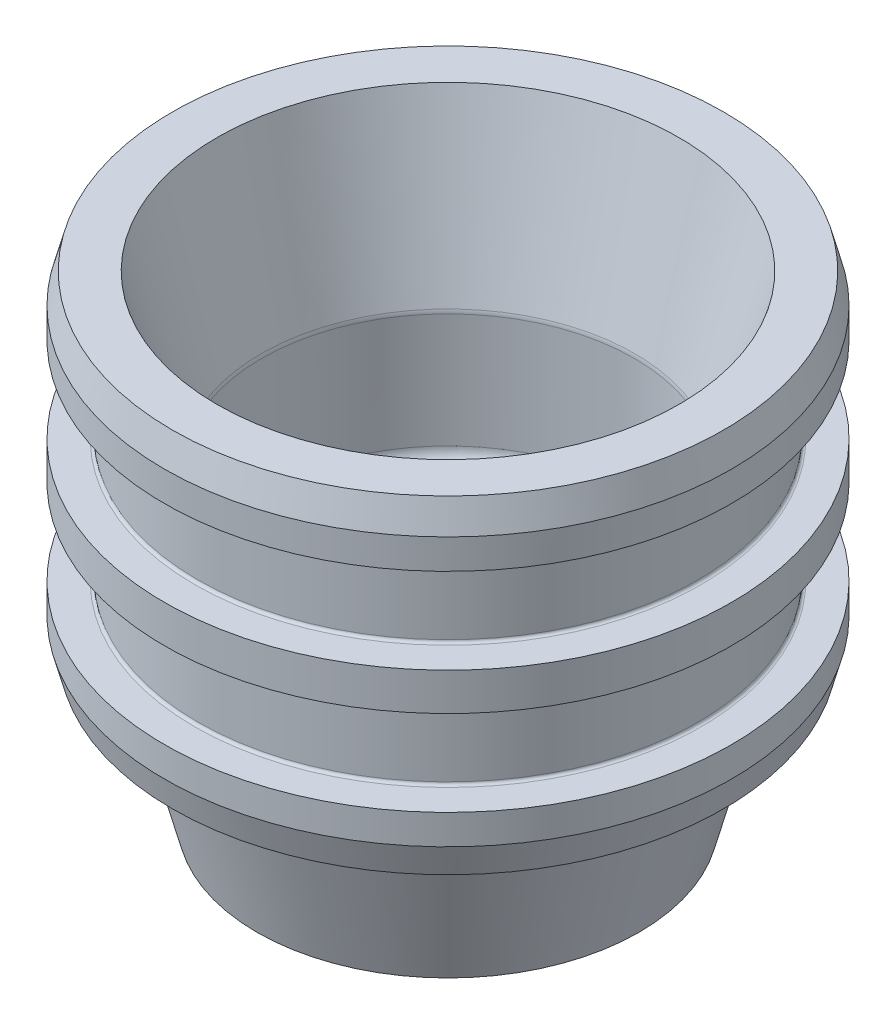
from build123d import *

# Parameters (mm, degrees)
SKETCH1_R                 = 24.1554
BODY_DEPTH                = 40.64
SKETCH2_R                 = 15.875
LIGHTENING_HOLE_DEPTH     = 25.4
INSTALL_CHAMFER_SIZE      = 2.54
INSTALL_CHAMFER_SIZE2     = 0.680590949
PROP_CHAMFER_SIZE         = 3.81
PROP_CHAMFER_SIZE2        = 14.219113577
SKETCH54_R                = 24.1554
SKETCH54_R_2              = 15.875
CONFORM_CUT_DEPTH         = 12.7
BOTTOM_PRESS_DRAFT_SIZE   = 3.81
BOTTOM_PRESS_DRAFT_SIZE_2 = 14.219113577
EDGE_BREAKS_R             = 1.27
INSTALL_CHAMFER_2_SIZE    = 2.54
INSTALL_CHAMFER_2_SIZE2   = 0.680590949


with BuildPart() as part:
    # Sketch1 → body (new body)
    with BuildSketch(Plane(origin=(0, 0, 0), x_dir=(1, 0, 0), z_dir=(0, 1, 0))):
        with Locations(Location((0, 0, 0), (0, 0, 270))):
            Circle(SKETCH1_R)
    extrude(amount=BODY_DEPTH)

    # Sketch2 → lightening hole (cut)
    with BuildSketch(Plane(origin=(0, 40.64, 0), x_dir=(1, 0, 0), z_dir=(0, 1, 0))):
        with Locations(Location((0, 0, 0), (0, 0, 270))):
            Circle(SKETCH2_R)
    extrude(amount=-LIGHTENING_HOLE_DEPTH, mode=Mode.SUBTRACT)

    # main-o-ring → o-ring-main (with backup rings) (revolve, cut)
    with BuildSketch(Plane.XY, mode=Mode.PRIVATE) as o_ring_main_with_backup_rings_sk:
        with BuildLine():
            Line((-24.1554, 35.56), (-24.1554, 28.2702))
            Line((-24.1554, 28.2702), (-21.550812385, 28.2702))
            ThreePointArc((-21.550812385, 28.2702), (-21.380956579, 28.340556579), (-21.3106, 28.510412385))
            Line((-21.3106, 28.510412385), (-21.3106, 35.319787615))
            ThreePointArc((-21.3106, 35.319787615), (-21.380956579, 35.489643421), (-21.550812385, 35.56))
            Line((-21.550812385, 35.56), (-24.1554, 35.56))
        make_face()
    o_ring_main_with_backup_rings = revolve(o_ring_main_with_backup_rings_sk.sketch.rotate(Axis((0, 0, 0), (0, 1, 0)), 270), axis=Axis((0, 0, 0), (0, 1, 0)), mode=Mode.SUBTRACT)

    # install-chamfer
    install_chamfer_edges = [part.edges().sort_by_distance(p)[0] for p in [
        (0, 40.64, -24.1554),
    ]]
    install_chamfer_side = [part.faces().sort_by_distance(p)[0] for p in [
        (0, 38.1, -24.1554),
    ]]
    chamfer(install_chamfer_edges, length=INSTALL_CHAMFER_SIZE, length2=INSTALL_CHAMFER_SIZE2, reference=install_chamfer_side[0])

    # prop-chamfer
    prop_chamfer_edges = [part.edges().sort_by_distance(p)[0] for p in [
        (0, 40.64, -15.875),
    ]]
    prop_chamfer_side = [part.faces().sort_by_distance(p)[0] for p in [
        (0, 40.64, -22.810841185),
    ]]
    chamfer(prop_chamfer_edges, length=PROP_CHAMFER_SIZE, length2=PROP_CHAMFER_SIZE2, reference=prop_chamfer_side[0])

    # Top-Bottom Symmetry: o-ring-main (with backup rings) across plane
    add(o_ring_main_with_backup_rings.mirror(Plane.ZX.offset(26.67)), mode=Mode.SUBTRACT)

    # Sketch54 → conform-cut (cut)
    with BuildSketch(Plane.XZ):
        with Locations(Location((0, 0, 0), (0, 0, 270))):
            Circle(SKETCH54_R)
        with Locations(Location((0, 0, 0), (0, 0, 90))):
            Circle(SKETCH54_R_2, mode=Mode.SUBTRACT)
    extrude(amount=-CONFORM_CUT_DEPTH, mode=Mode.SUBTRACT)

    # bottom-press-draft
    # the kernel refuses this chamfer: 14.219113577, 3.81 mm, written as the material it adds along each edge
    with BuildSketch(Plane(origin=(0, 12.7, 0), x_dir=(0, 0, 1), z_dir=(1, 0, 0))) as bottom_press_draft_piece_1_section:
        Polygon((15.875 + BOTTOM_PRESS_DRAFT_SIZE, 0), (15.875, BOTTOM_PRESS_DRAFT_SIZE_2), (15.875, 0), align=None)
    bottom_press_draft_piece_1 = revolve(axis=Axis((0, 12.7, 0), (0, -1, 0)), mode=Mode.PRIVATE)
    bottom_press_draft_piece_1 = split(bottom_press_draft_piece_1, bisect_by=Plane(origin=(0, 0, -17.911519777), z_dir=(0, 1, 0)), keep=Keep.TOP, mode=Mode.PRIVATE)
    add(bottom_press_draft_piece_1)

    # edge-breaks
    edge_breaks_edges = [part.edges().sort_by_distance(p)[0] for p in [
        (0, 26.420886423, -15.875),
        (0, 15.24, -15.875),
    ]]
    fillet(edge_breaks_edges, radius=EDGE_BREAKS_R)

    # install-chamfer-2
    install_chamfer_2_edges = [part.edges().sort_by_distance(p)[0] for p in [
        (0, 12.7, -24.1554),
    ]]
    install_chamfer_2_side = [part.faces().sort_by_distance(p)[0] for p in [
        (0, 15.24, -24.1554),
    ]]
    chamfer(install_chamfer_2_edges, length=INSTALL_CHAMFER_2_SIZE, length2=INSTALL_CHAMFER_2_SIZE2, reference=install_chamfer_2_side[0])


solid = part.part
